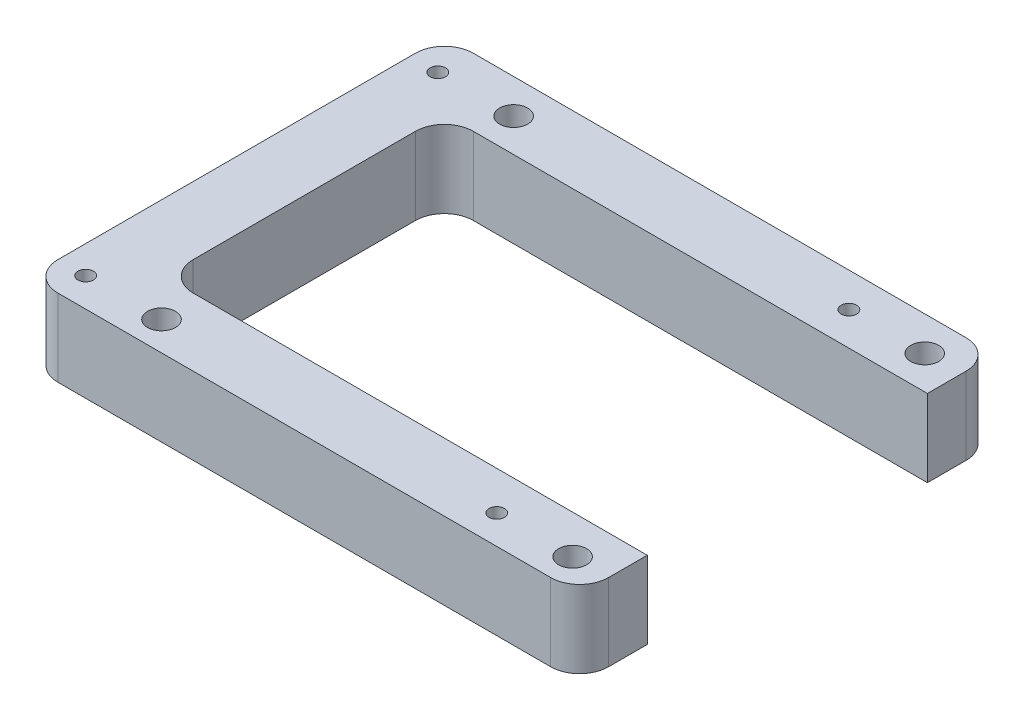
from build123d import *

# Parameters (mm, degrees)
SKETCH1_W                      = 57
SKETCH1_H                      = 43
BOSS_EXTRUDE1_DEPTH            = 8
SKETCH2_W                      = 50
SKETCH2_H                      = 29
CUT_EXTRUDE1_DEPTH             = 8
FILLET1_R                      = 3
M2X0_4_TAPPED_HOLE1_D          = 1.6
CBORE_FOR_M2_SHCS1_D           = 2.9
CBORE_FOR_M2_SHCS1_CBORE_D     = 4.9
CBORE_FOR_M2_SHCS1_CBORE_DEPTH = 5.5


with BuildPart() as part:
    # Sketch1 → Boss-Extrude1 (new body)
    with BuildSketch(Plane(origin=(0, 0, 0), x_dir=(1, 0, 0), z_dir=(0, 1, 0))):
        Rectangle(SKETCH1_W, SKETCH1_H)
    extrude(amount=BOSS_EXTRUDE1_DEPTH)

    # Sketch2 → Cut-Extrude1 (cut)
    with BuildSketch(Plane(origin=(0, 0, 0), x_dir=(1, 0, 0), z_dir=(0, 1, 0))):
        with Locations((3.5, 0)):
            Rectangle(SKETCH2_W, SKETCH2_H)
    extrude(amount=CUT_EXTRUDE1_DEPTH, mode=Mode.SUBTRACT)

    # Fillet1
    fillet1_edges = [part.edges().sort_by_distance(p)[0] for p in [
        (-28.5, 4, -21.5),
        (-28.5, 4, 21.5),
        (28.5, 4, -21.5),
        (28.5, 4, 21.5),
        (-21.5, 4, 14.5),
        (-21.5, 4, -14.5),
    ]]
    fillet(fillet1_edges, radius=FILLET1_R)

    # M2x0.4 Tapped Hole1 (through all)
    with Locations(Plane(origin=(0, 0, 0), x_dir=(-1, 0, 0), z_dir=(0, -1, 0))):
        with Locations((25.63, 17.95), (25.63, -18.5), (-16.92, -18.5), (-16.92, 17.95)):
            Hole(M2X0_4_TAPPED_HOLE1_D / 2)

    # CBORE for M2 SHCS1 (through all)
    with Locations(Plane(origin=(0, 0, 0), x_dir=(-1, 0, 0), z_dir=(0, -1, 0))):
        with Locations((-24.77, 17.95), (17.78, 17.95), (17.78, -18.5), (-24.77, -18.5)):
            CounterBoreHole(CBORE_FOR_M2_SHCS1_D / 2, CBORE_FOR_M2_SHCS1_CBORE_D / 2, CBORE_FOR_M2_SHCS1_CBORE_DEPTH)


solid = part.part
